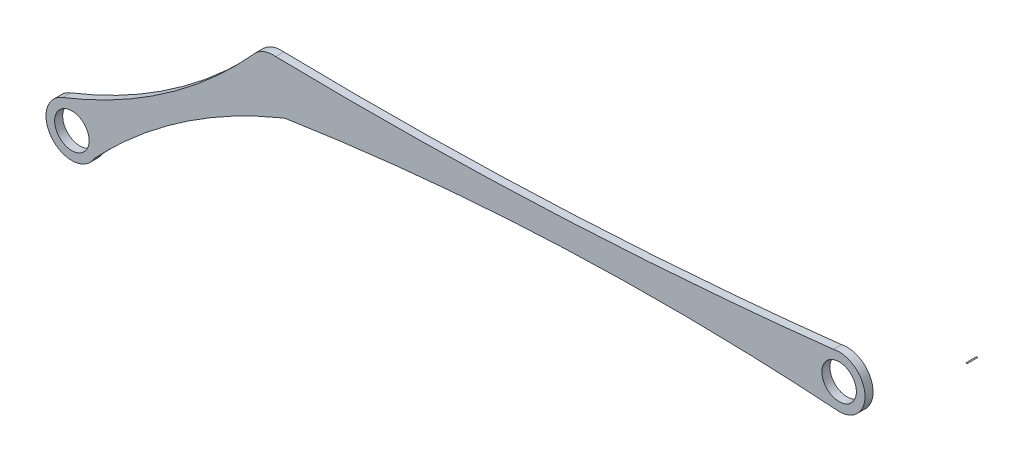
from build123d import *

# Parameters (mm, degrees)
SKETCH1_R           = 8.466666582
BOSS_EXTRUDE1_DEPTH = 3.96875
CUT_EXTRUDE1_DEPTH  = 324.071313784
SCALE1_SCALE        = 0.75


with BuildPart() as part:
    # Sketch1 → Boss-Extrude1 (new body)
    with BuildSketch(Plane.XY):
        with BuildLine():
            Line((278.579111194, 25.386731605), (7.002261578, 16.605199607))
            ThreePointArc((7.002261578, 16.605199607), (3.572001438, 17.66366686), (0, 18.021218638))
            ThreePointArc((0, 18.021218638), (-5.566811259, 17.139863874), (-10.589115987, 14.582007538))
            Line((-10.589115987, 14.582007538), (-112.456168951, -61.260615837))
            ThreePointArc((-112.456168951, -61.260615837), (-117.661054869, -96.802551105), (-82.119119601, -102.007437023))
            Line((-82.119119601, -102.007437023), (2.626401935, -38.912231208))
            ThreePointArc((2.626401935, -38.912231208), (9.416461191, -35.307290789), (16.974037803, -33.898910196))
            Line((16.974037803, -33.898910196), (280.220888806, -25.386731605))
            ThreePointArc((280.220888806, -25.386731605), (304.786731605, 0.820888806), (278.579111194, 25.386731605))
        make_face()
        with Locations((-97.287644276, -81.63402643)):
            Circle(SKETCH1_R, mode=Mode.SUBTRACT)
        with Locations((279.4, 0)):
            Circle(SKETCH1_R, mode=Mode.SUBTRACT)
    extrude(amount=BOSS_EXTRUDE1_DEPTH)

    # Sketch2 → Cut-Extrude1 (cut, through all)
    with BuildSketch(Plane.XY.offset(3.96875)):
        with BuildLine():
            Line((-53.969446012, -4.744671806), (-134.329544165, -73.239132517))
            ThreePointArc((-134.329544165, -73.239132517), (-125.60525441, -106.945872422), (-93.084490484, -119.382007693))
            Line((-93.084490484, -119.382007693), (5.391196219, -67.591740386))
            Line((5.391196219, -67.591740386), (280.559963716, -25.373499644))
            ThreePointArc((280.559963716, -25.373499644), (304.773499644, 1.159963716), (278.240036284, 25.373499644))
            Line((278.240036284, 25.373499644), (46.741351585, 20.654902712))
            ThreePointArc((46.741351585, 20.654902712), (-12.131424739, 41.72701519), (-53.969446012, -4.744671806))
        make_face()
        with BuildLine():
            add(Edge.make_bspline(
                [(7.343872653, -24.024450777), (141.939870387, -3.391503831), (277.670553151, -12.58169359)],
                knots=[0, 0, 0, 0.993669622, 0.993669622, 0.993669622], degree=2))
            ThreePointArc((7.343872653, -24.024450777), (6.384059671, -24.462532684), (5.391196219, -24.819434467))
            add(Edge.make_bspline(
                [(5.391196219, -24.819434467), (-47.371168783, -46.53348503), (-86.207298162, -87.840146796)],
                knots=[0.018124898, 0.018124898, 0.018124898, 1, 1, 1], degree=2))
            ThreePointArc((-86.207298162, -87.840146796), (-106.918618869, -89.912572703), (-101.759421239, -69.747344354))
            add(Edge.make_bspline(
                [(-101.759421239, -69.747344354), (-47.637210532, -48.302448827), (-8.304397238, -4.744671806)],
                knots=[0.003611947, 0.003611947, 0.003611947, 1, 1, 1], degree=2))
            ThreePointArc((-8.304397238, -4.744671806), (-4.207074532, -1.402956863), (0.895916614, -0.019268502))
            ThreePointArc((0.895916614, -0.019268502), (1.85975658, -0.002755052), (2.822072535, -0.059395822))
            add(Edge.make_bspline(
                [(2.822072535, -0.059395822), (140.13746109, -2.856877681), (276.581108414, 12.383208398)],
                knots=[0.010068083, 0.010068083, 0.010068083, 0.989878349, 0.989878349, 0.989878349], degree=2))
            ThreePointArc((276.581108414, 12.383208398), (292.087924513, 0.553689039), (277.670553151, -12.58169359))
        make_face(mode=Mode.SUBTRACT)
    extrude(amount=-CUT_EXTRUDE1_DEPTH, mode=Mode.SUBTRACT)


with BuildPart() as cut_extrude1_piece_1:
    # of the separate pieces the step leaves, piece 1, a body of its own (cut_extrude1_pieces)
    add(part.part.solids().sort_by_distance((-101.759421239, -69.747344354, 0))[0])


with BuildPart() as cut_extrude1_piece_2:
    # of the separate pieces the step leaves, piece 2, a body of its own (cut_extrude1_pieces)
    add(part.part.solids().sort_by_distance((278.579111194, 25.386731605, 0))[0])


with BuildPart() as cut_extrude1_piece_1_1:
    # Scale1: scaled about (85.471776317, -17.785934124, 1.984374998)
    add(cut_extrude1_piece_1.part.scale(SCALE1_SCALE).moved(Location((21.367944079, -4.446483531, 0.49609375))))


solid = Compound([cut_extrude1_piece_2.part, cut_extrude1_piece_1_1.part])
